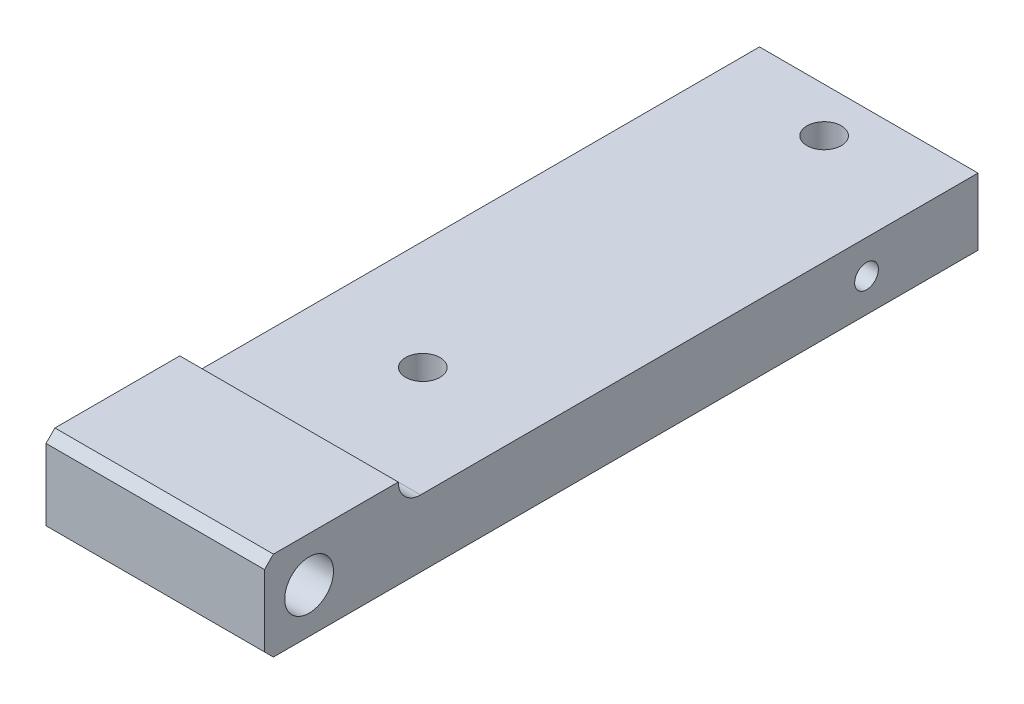
from build123d import *

# Parameters (mm, degrees)
SKETCH1_W               = 62.23
SKETCH1_H               = 25.4
BOSS_EXTRUDE1_DEPTH     = 203.2
F_3_8_CLEARANCE_HOLE1_D = 9.8044
F_1_2_CLEARANCE_HOLE1_D = 13.89126
SKETCH16_W              = 62.23
SKETCH16_H              = 165.1
CUT_EXTRUDE2_DEPTH      = 6.35
FILLET1_R               = 6.35
CHAMFER1_SIZE           = 2.54
F_1_4_CLEARANCE_HOLE1_D = 6.7564


with BuildPart() as part:
    # Sketch1 → Boss-Extrude1 (new body)
    with BuildSketch(Plane.XY):
        Rectangle(SKETCH1_W, SKETCH1_H)
    extrude(amount=BOSS_EXTRUDE1_DEPTH)

    # 3/8 Clearance Hole1 (through all)
    with Locations(Plane(origin=(0, 12.7, 0), x_dir=(1, 0, 0), z_dir=(0, 1, 0))):
        with Locations((0, -12.7), (0, -127)):
            Hole(F_3_8_CLEARANCE_HOLE1_D / 2)

    # 1/2 Clearance Hole1 (through all)
    with Locations(Plane(origin=(31.115, 0, 0), x_dir=(0, 0, -1), z_dir=(1, 0, 0))):
        with Locations((-190.5, 0)):
            Hole(F_1_2_CLEARANCE_HOLE1_D / 2)

    # Sketch16 → Cut-Extrude2 (cut)
    with BuildSketch(Plane.XZ.offset(-12.7)):
        with Locations((0, 82.55)):
            Rectangle(SKETCH16_W, SKETCH16_H)
    extrude(amount=CUT_EXTRUDE2_DEPTH, mode=Mode.SUBTRACT)

    # Fillet1
    fillet1_edges = [part.edges().sort_by_distance(p)[0] for p in [
        (0, 6.35, 165.1),
    ]]
    fillet(fillet1_edges, radius=FILLET1_R - 0.0001)  # a hair under: the kernel refuses the full size

    # Chamfer1
    chamfer1_edges = [part.edges().sort_by_distance(p)[0] for p in [
        (0, -12.7, 203.2),
        (0, 12.7, 203.2),
    ]]
    chamfer(chamfer1_edges, length=CHAMFER1_SIZE)

    # 1/4 Clearance Hole1 (through all)
    with Locations(Plane(origin=(31.115, 0, 0), x_dir=(0, 0, -1), z_dir=(1, 0, 0))):
        with Locations((-31.75, -3.175)):
            Hole(F_1_4_CLEARANCE_HOLE1_D / 2)


solid = part.part
